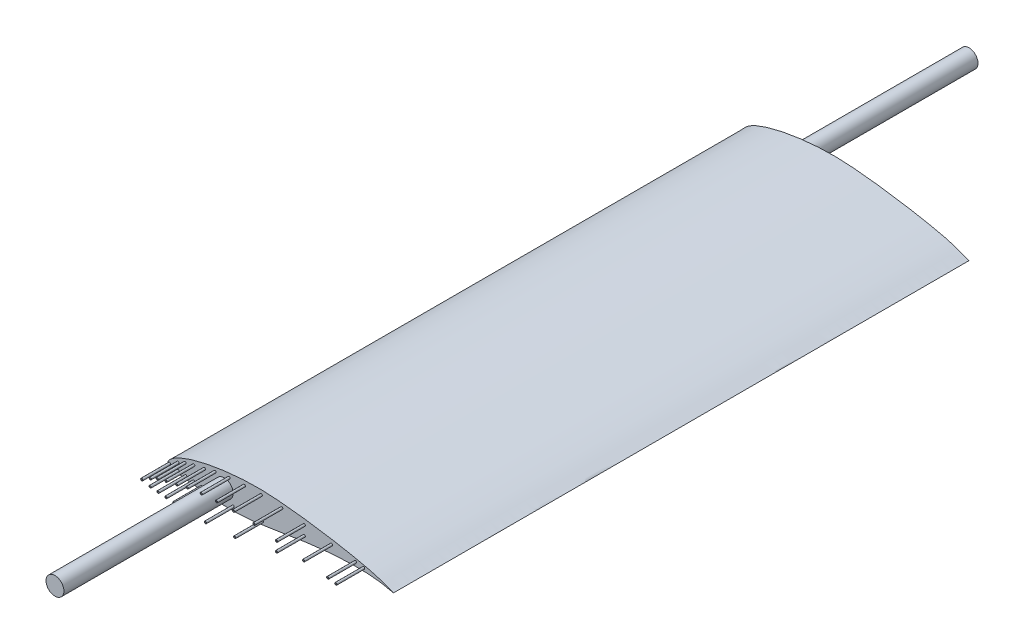
from build123d import *

# Parameters (mm, degrees)
BOSS_EXTRUDE12_DEPTH = 127.5
SKETCH5_R            = 3.96875
BOSS_EXTRUDE13_DEPTH = 75
SKETCH6_R            = 0.495
SKETCH6_R_2          = 0.325
BOSS_EXTRUDE14_DEPTH = 12.3


with BuildPart() as part:
    # Sketch4 → Boss-Extrude12 (new, symmetric)
    with BuildSketch(Plane.XY):
        with BuildLine():
            add(Edge.make_bspline(
                [(100, 0), (99.999815651, 0.00219446), (99.296084263, 0.199325454), (98.61912609, 0.462023876), (97.051903925, 1.047271604), (95.230890561, 1.754893562), (92.9377884, 2.556822624), (90.25359521, 3.333646696), (87.14769009, 4.081591717), (83.653453523, 4.844892949), (79.805092278, 5.612624789), (75.655096387, 6.378178082), (71.256775037, 7.128421187), (66.666591084, 7.848408623), (61.942283988, 8.521247582), (57.141991664, 9.126935326), (52.323298642, 9.644744891), (47.542171635, 10.046664095), (42.847412803, 10.315684788), (38.250859013, 10.364237329), (33.766527631, 10.18589116), (29.404540771, 9.859979537), (25.205664918, 9.396335122), (21.214632991, 8.814476405), (17.473244617, 8.129616096), (14.021102758, 7.355738731), (10.893158298, 6.510046925), (8.121057405, 5.603939), (5.729621281, 4.65858742), (3.739238835, 3.686482523), (2.162902466, 2.71622035), (1.005702209, 1.767062286), (0.309881961, 0.924053983), (0.033562392, 0.326864353), (0.000585058, 0.059003832), (-0.000483325, -0.044055324), (0.008656559, -0.147243843), (0.097628215, -0.280738124), (0.217608326, -0.405627954), (0.606875055, -0.718520627), (1.515593418, -1.12387328), (3.070469813, -1.582990093), (5.152338499, -2.007169493), (7.727947017, -2.391694307), (10.775863297, -2.749884099), (14.2510745, -3.07721248), (18.040671125, -3.477315031), (22.041442034, -3.906718484), (26.216607049, -4.117145276), (30.556543108, -4.098285525), (35.101357612, -3.847566364), (39.855502399, -3.292896418), (44.853099151, -2.569694917), (50.077701264, -1.697246438), (55.496912305, -0.808938969), (61.034492206, 0.024429539), (66.590101657, 0.742311194), (72.054909857, 1.301282359), (77.316713376, 1.672844408), (82.260760219, 1.841731341), (86.778399144, 1.811995519), (90.728856588, 1.57974732), (94.04764875, 1.181997505), (96.524332979, 0.771531232), (98.476024493, 0.356901303), (99.25725067, 0.188333084), (100.000186154, -0.002215951), (100, 0)],
                knots=[0, 0, 0, 0, 0.001709346, 0.006654569, 0.014347849, 0.024259402, 0.036041711, 0.049641116, 0.065254712, 0.082792535, 0.102030591, 0.122721356, 0.144596581, 0.167375109, 0.190767639, 0.214482745, 0.238232803, 0.261741379, 0.284746803, 0.307088371, 0.329034071, 0.350454748, 0.371139118, 0.390890019, 0.409511982, 0.426831344, 0.442689348, 0.456949713, 0.469522756, 0.480321822, 0.489349767, 0.496580446, 0.502134718, 0.505253957, 0.506016052, 0.506062921, 0.506764306, 0.507485535, 0.508355904, 0.509303967, 0.514776148, 0.522722026, 0.533080486, 0.545839741, 0.560863123, 0.578017517, 0.59696103, 0.61667464, 0.636937396, 0.658148346, 0.680211445, 0.703561467, 0.728221439, 0.754163514, 0.781135914, 0.808648743, 0.836174178, 0.863169877, 0.889092097, 0.913409262, 0.93561843, 0.955186622, 0.971480112, 0.984125393, 0.993028694, 0.998273914, 1, 1, 1, 1], degree=3))
        make_face()
    extrude(amount=BOSS_EXTRUDE12_DEPTH, both=True)

    # Sketch5 → Boss-Extrude13 (add)
    with BuildSketch(Plane.XY.offset(127.5)):
        with Locations((25, 2.7)):
            Circle(SKETCH5_R)
    boss_extrude13 = extrude(amount=BOSS_EXTRUDE13_DEPTH)

    # Mirror1: Boss-Extrude13 across plane
    add(boss_extrude13.mirror(Plane.XY))

    # Sketch6 → Boss-Extrude14 (add)
    # profile 1 of 21: a face of its own
    with BuildSketch(Plane.XY.offset(127.5)):
        with Locations((0.75, 0)):
            Circle(SKETCH6_R)
        with Locations((0.75, 0)):
            Circle(SKETCH6_R_2, mode=Mode.SUBTRACT)
    # profile 2 of 21: a face of its own
    with BuildSketch(Plane.XY.offset(127.5)):
        with Locations((86.76, 3)):
            Circle(SKETCH6_R)
        with Locations((86.76, 3)):
            Circle(SKETCH6_R_2, mode=Mode.SUBTRACT)
    # profile 3 of 21: a face of its own
    with BuildSketch(Plane.XY.offset(127.5)):
        with Locations((83.16, 3.5)):
            Circle(SKETCH6_R)
        with Locations((83.16, 3.5)):
            Circle(SKETCH6_R_2, mode=Mode.SUBTRACT)
    # profile 4 of 21: a face of its own
    with BuildSketch(Plane.XY.offset(127.5)):
        with Locations((72.5, 4.8)):
            Circle(SKETCH6_R)
        with Locations((72.5, 4.8)):
            Circle(SKETCH6_R_2, mode=Mode.SUBTRACT)
    # profile 5 of 21: a face of its own
    with BuildSketch(Plane.XY.offset(127.5)):
        with Locations((60.442948122, 6.3)):
            Circle(SKETCH6_R)
        with Locations((60.442948122, 6.3)):
            Circle(SKETCH6_R_2, mode=Mode.SUBTRACT)
    # profile 6 of 21: a face of its own
    with BuildSketch(Plane.XY.offset(127.5)):
        with Locations((60.442948122, 2.15)):
            Circle(SKETCH6_R)
        with Locations((60.442948122, 2.15)):
            Circle(SKETCH6_R_2, mode=Mode.SUBTRACT)
    # profile 7 of 21: a face of its own
    with BuildSketch(Plane.XY.offset(127.5)):
        with Locations((50.465206467, 7.80092354)):
            Circle(SKETCH6_R)
        with Locations((50.465206467, 7.80092354)):
            Circle(SKETCH6_R_2, mode=Mode.SUBTRACT)
    # profile 8 of 21: a face of its own
    with BuildSketch(Plane.XY.offset(127.5)):
        with Locations((41.41991965, 8.317049878)):
            Circle(SKETCH6_R)
        with Locations((41.41991965, 8.317049878)):
            Circle(SKETCH6_R_2, mode=Mode.SUBTRACT)
    # profile 9 of 21: a face of its own
    with BuildSketch(Plane.XY.offset(127.5)):
        with Locations((33.87991965, 8.117049878)):
            Circle(SKETCH6_R)
        with Locations((33.87991965, 8.117049878)):
            Circle(SKETCH6_R_2, mode=Mode.SUBTRACT)
    # profile 10 of 21: a face of its own
    with BuildSketch(Plane.XY.offset(127.5)):
        with Locations((27.13991965, 7.767049878)):
            Circle(SKETCH6_R)
        with Locations((27.13991965, 7.767049878)):
            Circle(SKETCH6_R_2, mode=Mode.SUBTRACT)
    # profile 11 of 21: a face of its own
    with BuildSketch(Plane.XY.offset(127.5)):
        with Locations((20.90991965, 6.967049878)):
            Circle(SKETCH6_R)
        with Locations((20.90991965, 6.967049878)):
            Circle(SKETCH6_R_2, mode=Mode.SUBTRACT)
    # profile 12 of 21: a face of its own
    with BuildSketch(Plane.XY.offset(127.5)):
        with Locations((16.221039186, 5.767049878)):
            Circle(SKETCH6_R)
        with Locations((16.221039186, 5.767049878)):
            Circle(SKETCH6_R_2, mode=Mode.SUBTRACT)
    # profile 13 of 21: a face of its own
    with BuildSketch(Plane.XY.offset(127.5)):
        with Locations((11.485471639, 4.767049878)):
            Circle(SKETCH6_R)
        with Locations((11.485471639, 4.767049878)):
            Circle(SKETCH6_R_2, mode=Mode.SUBTRACT)
    # profile 14 of 21: a face of its own
    with BuildSketch(Plane.XY.offset(127.5)):
        with Locations((7.612488292, 3.767049878)):
            Circle(SKETCH6_R)
        with Locations((7.612488292, 3.767049878)):
            Circle(SKETCH6_R_2, mode=Mode.SUBTRACT)
    # profile 15 of 21: a face of its own
    with BuildSketch(Plane.XY.offset(127.5)):
        with Locations((4.505641016, 2.267049878)):
            Circle(SKETCH6_R)
        with Locations((4.505641016, 2.267049878)):
            Circle(SKETCH6_R_2, mode=Mode.SUBTRACT)
    # profile 16 of 21: a face of its own
    with BuildSketch(Plane.XY.offset(127.5)):
        with Locations((4.505641016, -0.85)):
            Circle(SKETCH6_R)
        with Locations((4.505641016, -0.85)):
            Circle(SKETCH6_R_2, mode=Mode.SUBTRACT)
    # profile 17 of 21: a face of its own
    with BuildSketch(Plane.XY.offset(127.5)):
        with Locations((7.992760171, -1.15)):
            Circle(SKETCH6_R)
        with Locations((7.992760171, -1.15)):
            Circle(SKETCH6_R_2, mode=Mode.SUBTRACT)
    # profile 18 of 21: a face of its own
    with BuildSketch(Plane.XY.offset(127.5)):
        with Locations((11.479879325, -1.45)):
            Circle(SKETCH6_R)
        with Locations((11.479879325, -1.45)):
            Circle(SKETCH6_R_2, mode=Mode.SUBTRACT)
    # profile 19 of 21: a face of its own
    with BuildSketch(Plane.XY.offset(127.5)):
        with Locations((14.956947056, -1.85)):
            Circle(SKETCH6_R)
        with Locations((14.956947056, -1.85)):
            Circle(SKETCH6_R_2, mode=Mode.SUBTRACT)
    # profile 20 of 21: a face of its own
    with BuildSketch(Plane.XY.offset(127.5)):
        with Locations((28.948015635, -2.35)):
            Circle(SKETCH6_R)
        with Locations((28.948015635, -2.35)):
            Circle(SKETCH6_R_2, mode=Mode.SUBTRACT)
    # profile 21 of 21: a face of its own
    with BuildSketch(Plane.XY.offset(127.5)):
        with Locations((41.923376902, -1.55)):
            Circle(SKETCH6_R)
        with Locations((41.923376902, -1.55)):
            Circle(SKETCH6_R_2, mode=Mode.SUBTRACT)
    extrude(amount=BOSS_EXTRUDE14_DEPTH)


solid = part.part
